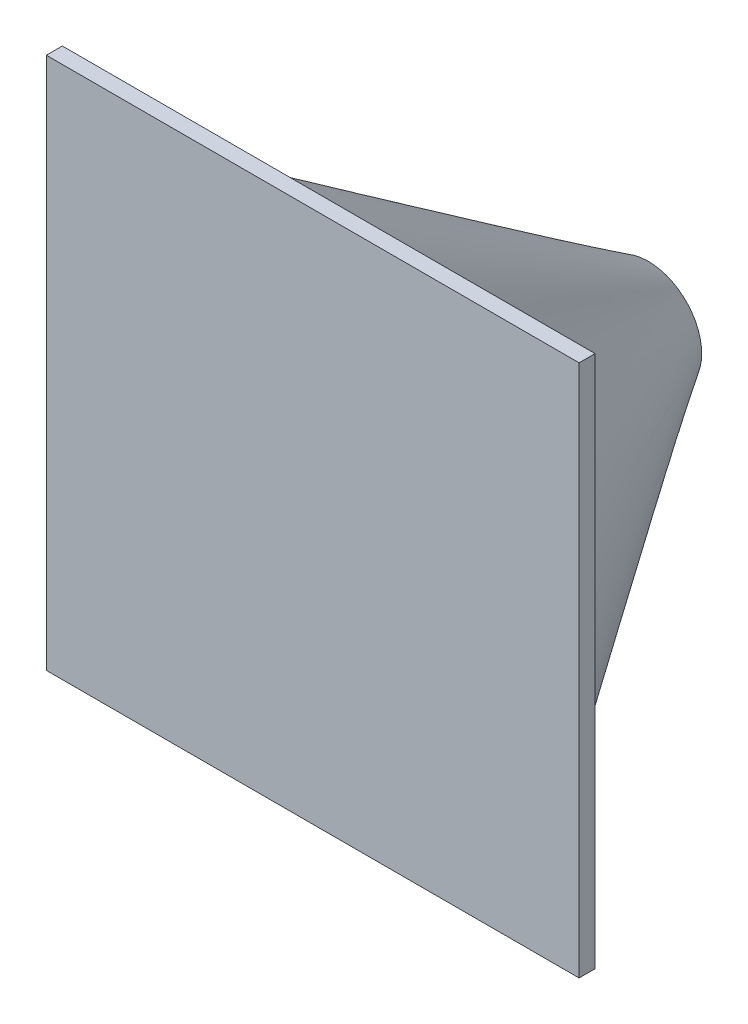
from build123d import *

# Parameters (mm, degrees)
EXTRUDE_1_DEPTH = 15


with BuildPart() as part:
    # 放样1: read off the stored shape, not the designer's step
    # 放样1: loft between two sections, ruled curve by curve
    loft_1_from = [
        Edge.make_bspline([(157.289403045, 194.319437241, 300), (545.928277528, -120.259368848, 300), (231.349471438, -508.898243331, 300), (-157.289403045, -194.319437241, 300), (-545.928277528, 120.259368848, 300), (-231.349471438, 508.898243331, 300), (157.289403045, 194.319437241, 300)], [0, 0, 0, 0, 0.5, 0.5, 0.5, 1, 1, 1, 1], 3, [1, 0.333333333, 0.333333333, 1, 0.333333333, 0.333333333, 1]),
    ]
    loft_1_to = [
        Edge.make_bspline([(42.317097013, 26.631997679, 0), (95.581092372, -58.002196347, 0), (10.946898346, -111.266191705, 0), (-42.317097013, -26.631997679, 0), (-95.581092372, 58.002196347, 0), (-10.946898346, 111.266191705, 0), (42.317097013, 26.631997679, 0)], [0, 0, 0, 0, 0.5, 0.5, 0.5, 1, 1, 1, 1], 3, [1, 0.333333333, 0.333333333, 1, 0.333333333, 0.333333333, 1]),
    ]
    loft_1 = Solid(Shell([*[Face.make_surface_from_curves(loft_1_from[k], loft_1_to[k]) for k in range(1)], Face(Wire(loft_1_from)), Face(Wire(loft_1_to))]))
    add(loft_1)

    # 草图4 → 凸台-拉伸1 (add)
    with BuildSketch(Plane.XY.offset(300)):
        Polygon((0, 250), (-250, 250), (-250, -250), (250, -250), (250, 250), align=None)
    extrude(amount=EXTRUDE_1_DEPTH)


solid = part.part
